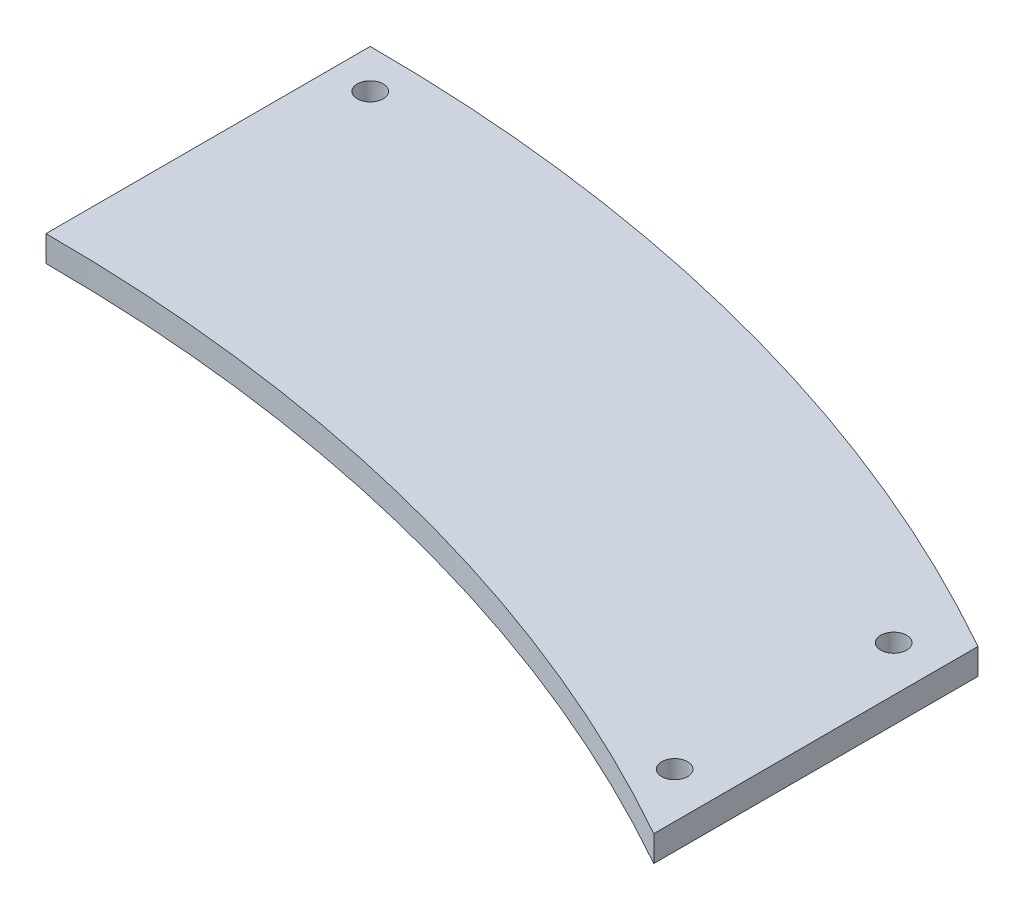
from build123d import *

# Parameters (mm, degrees)
SKETCH1_R           = 1
BOSS_EXTRUDE1_DEPTH = 2


with BuildPart() as part:
    # Sketch1 → Boss-Extrude1 (new body)
    with BuildSketch(Plane(origin=(0, 0, 0), x_dir=(1, 0, 0), z_dir=(0, 1, 0))):
        with BuildLine():
            Line((63.5, 0), (63.5, 25))
            ThreePointArc((63.5, 25), (32.821577972, 37.408371215), (0, 41.636523743))
            Line((0, 41.636523743), (0, 16.636523743))
            ThreePointArc((0, 16.636523743), (32.821577972, 12.408371215), (63.5, 0))
        make_face()
        with Locations((60, 5.111607411)):
            Circle(SKETCH1_R, mode=Mode.SUBTRACT)
        with Locations((3, 38.636523743)):
            Circle(SKETCH1_R, mode=Mode.SUBTRACT)
        with Locations((60, 22)):
            Circle(SKETCH1_R, mode=Mode.SUBTRACT)
    extrude(amount=BOSS_EXTRUDE1_DEPTH)


solid = part.part
